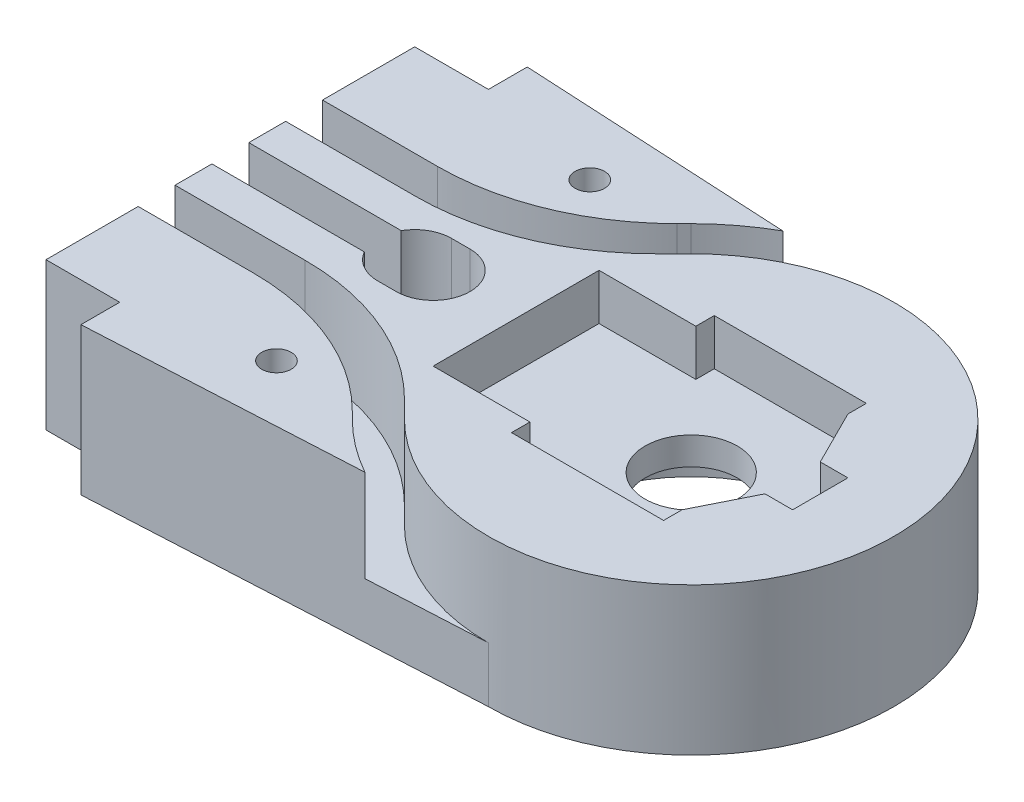
from build123d import *
from build123d.topology import SkipClean

# Parameters (mm, degrees)
SKETCH1_R                       = 2.5
BOSS_EXTRUDE1_DEPTH             = 8
SKETCH2_R                       = 0.8
SCREW_HOLES_DEPTH               = 52.103203384
SKETCH10_R                      = 1.25
SCREW_HEADS_DEPTH               = 2
DISTAL_MIDDLE_START             = 3
DISTAL_MIDDLE_CABLE_CANAL_DEPTH = 5
POT_START                       = 8
POT_INSERT_DEPTH                = 2.5
CUT_EXTRUDE1_START              = 3
CUT_EXTRUDE1_DEPTH              = 5
SKETCH7_R                       = 7.5
CUT_EXTRUDE2_DEPTH              = 4


with BuildPart() as part:
    # Sketch1 → Boss-Extrude1 (new body)
    with BuildSketch(Plane(origin=(0, 0, 0), x_dir=(1, 0, 0), z_dir=(0, 1, 0))):
        with BuildLine():
            Line((13, 10), (13, -10))
            Line((13, -10), (17, -10))
            Line((17, -10), (17, -12.105263158))
            Line((17, -12.105263158), (38, -11))
            ThreePointArc((38, -11), (49, 0), (38, 11))
            Line((38, 11), (17, 12.105263158))
            Line((17, 12.105263158), (17, 10))
            Line((17, 10), (13, 10))
        make_face()
        with Locations((38, 0)):
            Circle(SKETCH1_R, mode=Mode.SUBTRACT)
    extrude(amount=BOSS_EXTRUDE1_DEPTH)

    # Sketch2 → Screw Holes (cut, through all)
    with BuildSketch(Plane(origin=(0, 0, 0), x_dir=(1, 0, 0), z_dir=(0, 1, 0))):
        with Locations((24, 8.5)):
            Circle(SKETCH2_R)
        with Locations((24, 0)):
            Circle(SKETCH2_R)
        with Locations((24, -8.5)):
            Circle(SKETCH2_R)
    extrude(amount=SCREW_HOLES_DEPTH, mode=Mode.SUBTRACT)

    # Sketch10 → Screw Heads (cut)
    with BuildSketch(Plane(origin=(0, 0, 0), x_dir=(1, 0, 0), z_dir=(0, 1, 0))):
        with Locations((24, 0)):
            Circle(SKETCH10_R)
    extrude(amount=SCREW_HEADS_DEPTH, mode=Mode.SUBTRACT)

    # Sketch 3 → Distal/Middle Cable Canal (cut)
    with SkipClean():  # the faces are left unmerged after this step: merging them gives an invalid solid
        with BuildSketch(Plane(origin=(0, 0, 0), x_dir=(1, 0, 0), z_dir=(0, 1, 0)).offset(DISTAL_MIDDLE_START)):
            with BuildLine():
                Line((19, 5), (13, 5))
                Line((13, 5), (13, 3))
                Line((13, 3), (19, 3))
                Line((19, 3), (20.058874503, 3))
                ThreePointArc((20.058874503, 3), (25.033759124, 3.989566077), (29.251262658, 6.807611845))
                Line((29.251262658, 6.807611845), (30.221825407, 7.778174593))
                ThreePointArc((30.221825407, 7.778174593), (33.790482244, 10.162674858), (38, 11))
                Line((38, 11), (31.634673214, 11.335017199))
                ThreePointArc((31.634673214, 11.335017199), (30.147717634, 10.360582109), (28.807611845, 9.192388155))
                Line((28.807611845, 9.192388155), (28.422835534, 8.807611845))
                ThreePointArc((28.422835534, 8.807611845), (24.205331999, 5.989566077), (19.230447378, 5))
                Line((19.230447378, 5), (19, 5))
            make_face()
            with BuildLine():
                Line((19, -5), (13, -5))
                Line((13, -5), (13, -3))
                Line((13, -3), (19, -3))
                Line((19, -3), (20.058874503, -3))
                ThreePointArc((20.058874503, -3), (25.033759124, -3.989566077), (29.251262658, -6.807611845))
                Line((29.251262658, -6.807611845), (30.221825407, -7.778174593))
                ThreePointArc((30.221825407, -7.778174593), (33.790482244, -10.162674858), (38, -11))
                Line((38, -11), (31.634673214, -11.335017199))
                ThreePointArc((31.634673214, -11.335017199), (30.147717634, -10.360582109), (28.807611845, -9.192388155))
                Line((28.807611845, -9.192388155), (28.422835534, -8.807611845))
                ThreePointArc((28.422835534, -8.807611845), (24.205331999, -5.989566077), (19.230447378, -5))
                Line((19.230447378, -5), (19, -5))
            make_face()
        extrude(amount=DISTAL_MIDDLE_CABLE_CANAL_DEPTH, mode=Mode.SUBTRACT)

    # Sketch3 → Pot Insert (cut)
    with SkipClean():  # the faces are left unmerged after this step: merging them gives an invalid solid
        with BuildSketch(Plane(origin=(28.28760271, 0, 0), x_dir=(1, 0, 0), z_dir=(0, 1, 0)).offset(POT_START)):
            Polygon((16.71239729, 0), (16.71239729, 1.5), (15.21239729, 1.5), (13.71239729, 4.5), (13.71239729, 5.5), (9.71239729, 5.5), (5.46239729, 5.5), (5.46239729, 4.5), (0.21239729, 4.5), (0.21239729, 0), (0.21239729, -4.5), (5.46239729, -4.5), (5.46239729, -5.5), (9.71239729, -5.5), (13.71239729, -5.5), (13.71239729, -4.5), (15.21239729, -1.5), (16.71239729, -1.5), align=None)
        extrude(amount=-POT_INSERT_DEPTH, mode=Mode.SUBTRACT)

    # Sketch5 → Cut-Extrude1 (cut)
    with SkipClean():  # the faces are left unmerged after this step: merging them gives an invalid solid
        with BuildSketch(Plane(origin=(0, 0, 0), x_dir=(1, 0, 0), z_dir=(0, 1, 0)).offset(CUT_EXTRUDE1_START)):
            with BuildLine():
                Line((13, 1), (13, -1))
                Line((13, -1), (21.267949192, -1))
                ThreePointArc((21.267949192, -1), (22, -1.732050808), (23, -2))
                Line((23, -2), (24, -2))
                ThreePointArc((24, -2), (26, 0), (24, 2))
                Line((24, 2), (23, 2))
                ThreePointArc((23, 2), (22, 1.732050808), (21.267949192, 1))
                Line((21.267949192, 1), (13, 1))
            make_face()
        extrude(amount=CUT_EXTRUDE1_DEPTH, mode=Mode.SUBTRACT)

    # Sketch7 → Cut-Extrude2 (cut)
    with SkipClean():  # the faces are left unmerged after this step: merging them gives an invalid solid
        with BuildSketch(Plane(origin=(0, 0, 0), x_dir=(1, 0, 0), z_dir=(0, 1, 0))):
            with Locations((38, 0)):
                Circle(SKETCH7_R)
        extrude(amount=CUT_EXTRUDE2_DEPTH, mode=Mode.SUBTRACT)


solid = part.part
